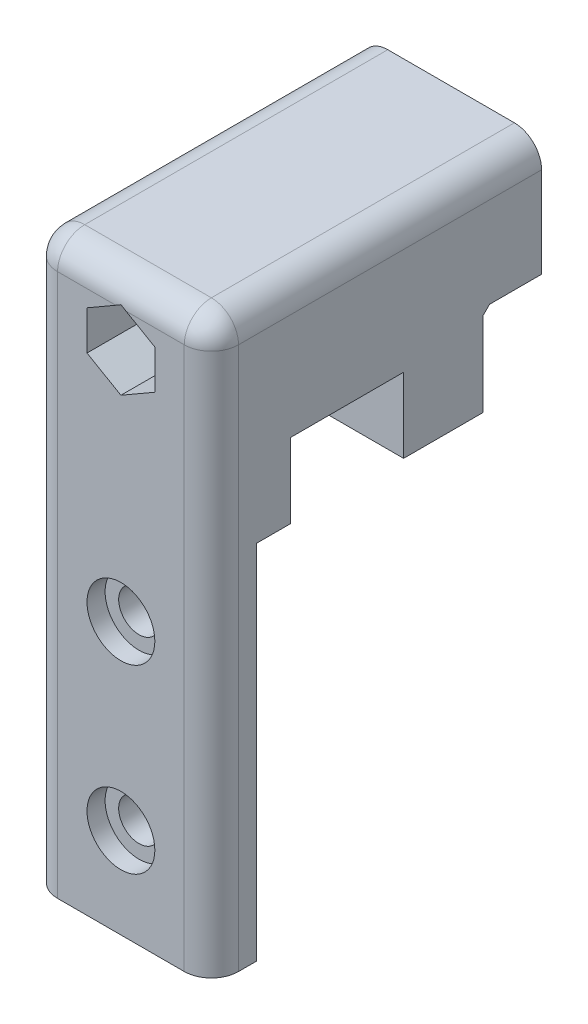
from build123d import *

# Parameters (mm, degrees)
BOSS_EXTRUDE1_DEPTH = 20
CUT_EXTRUDE1_REACH  = 58.482
SKETCH2_R           = 2.25
SKETCH3_W           = 20
SKETCH3_H           = 63
SKETCH3_R           = 3.75
BOSS_EXTRUDE2_DEPTH = 2
FILLET1_R           = 3
CUT_EXTRUDE2_DEPTH  = 10


with BuildPart() as part:
    # Sketch1 → Boss-Extrude1 (new body)
    with BuildSketch(Plane(origin=(0, 0, 0), x_dir=(0, 0, -1), z_dir=(1, 0, 0))):
        Polygon((8.75, 0), (8.75, 9.25), (9.5, 10), (15.25, 10), (15.25, 23), (-19.25, 23), (-19.25, -40), (-16.25, -40), (-16.25, 0), (-12.5, 0), (-12.5, 8.25), (0, 8.25), (0, 0), (3.75, 0), align=None)
    extrude(amount=BOSS_EXTRUDE1_DEPTH)

    # Sketch2 → Cut-Extrude1 (cut, up to next)
    with BuildSketch(Plane.XY.offset(19.25), mode=Mode.PRIVATE) as cut_extrude1_sk1:
        with Locations((10, -30)):
            Circle(SKETCH2_R)
    cut_extrude1_tool1 = extrude(cut_extrude1_sk1.sketch, amount=-CUT_EXTRUDE1_REACH, mode=Mode.PRIVATE) & part.part
    # Sketch2 → Cut-Extrude1 (cut, up to next)
    with BuildSketch(Plane.XY.offset(19.25), mode=Mode.PRIVATE) as cut_extrude1_sk2:
        with Locations((10, -10)):
            Circle(SKETCH2_R)
    cut_extrude1_tool2 = extrude(cut_extrude1_sk2.sketch, amount=-CUT_EXTRUDE1_REACH, mode=Mode.PRIVATE) & part.part
    # Sketch2 → Cut-Extrude1 (cut, up to next)
    with BuildSketch(Plane.XY.offset(19.25), mode=Mode.PRIVATE) as cut_extrude1_sk3:
        with Locations((10, 16)):
            Circle(SKETCH2_R)
    cut_extrude1_tool3 = extrude(cut_extrude1_sk3.sketch, amount=-CUT_EXTRUDE1_REACH, mode=Mode.PRIVATE) & part.part
    add(cut_extrude1_tool1.solids().sort_by_distance((10, -30, 19.25))[0], mode=Mode.SUBTRACT)
    add(cut_extrude1_tool2.solids().sort_by_distance((10, -10, 19.25))[0], mode=Mode.SUBTRACT)
    add(cut_extrude1_tool3.solids().sort_by_distance((10, 16, 19.25))[0], mode=Mode.SUBTRACT)

    # Sketch3 → Boss-Extrude2 (add)
    with BuildSketch(Plane.XY.offset(19.25)):
        with Locations((10, -8.5)):
            Rectangle(SKETCH3_W, SKETCH3_H)
        with Locations((10, -30)):
            Circle(SKETCH3_R, mode=Mode.SUBTRACT)
        with Locations((10, -10)):
            Circle(SKETCH3_R, mode=Mode.SUBTRACT)
        Polygon((13.75, 18.165063509), (10, 20.330127019), (6.25, 18.165063509), (6.25, 13.834936491), (10, 11.669872981), (13.75, 13.834936491), align=None, mode=Mode.SUBTRACT)
    extrude(amount=BOSS_EXTRUDE2_DEPTH)

    # Fillet1
    # the kernel refuses this fillet: 3 mm, written as the material it takes off along each edge
    with BuildSketch(Plane(origin=(3, 20, 18.25), x_dir=(0, 0, 1), z_dir=(-1, 0, 0))) as fillet1_piece_1_section:
        Polygon((0, 0), (FILLET1_R, 0), (FILLET1_R, FILLET1_R), (0, FILLET1_R), align=None)
    fillet1_piece_1 = extrude(amount=FILLET1_R, mode=Mode.PRIVATE)
    fillet1_piece_1 = fillet1_piece_1 - Plane(origin=(3, 20, 18.25), x_dir=(0, -0.7071067811865485, -0.7071067811865465), z_dir=(-1, 0, 0)) * Sphere(FILLET1_R, mode=Mode.PRIVATE)
    add(fillet1_piece_1, mode=Mode.SUBTRACT)
    with BuildSketch(Plane(origin=(17, 20, 18.25), x_dir=(0, 0, 1), z_dir=(1, 0, 0))) as fillet1_piece_2_section:
        Polygon((0, 0), (FILLET1_R, 0), (FILLET1_R, -FILLET1_R), (0, -FILLET1_R), align=None)
    fillet1_piece_2 = extrude(amount=FILLET1_R, mode=Mode.PRIVATE)
    fillet1_piece_2 = fillet1_piece_2 - Plane(origin=(17, 20, 18.25), x_dir=(0, -0.7071067811865485, -0.7071067811865465), z_dir=(1, 0, 0)) * Sphere(FILLET1_R, mode=Mode.PRIVATE)
    add(fillet1_piece_2, mode=Mode.SUBTRACT)
    with BuildSketch(Plane(origin=(0, 23, 18.25), x_dir=(1, 0, 0), z_dir=(0, 0, -1))) as fillet1_piece_3:
        with BuildLine():
            CenterArc((FILLET1_R, FILLET1_R), FILLET1_R, 180, 90)
            Line((0, FILLET1_R), (0, 0))
            Line((0, 0), (FILLET1_R, 0))
        make_face()
    extrude(amount=41, mode=Mode.SUBTRACT)
    with BuildSketch(Plane(origin=(20, 23, -22.75), x_dir=(0, -1, 0), z_dir=(0, 0, 1))) as fillet1_piece_4:
        with BuildLine():
            CenterArc((FILLET1_R, -FILLET1_R), FILLET1_R, 90, 90)
            Line((0, -FILLET1_R), (0, 0))
            Line((0, 0), (FILLET1_R, 0))
        make_face()
    extrude(amount=41, mode=Mode.SUBTRACT)
    with BuildSketch(Plane(origin=(17, 23, 21.25), x_dir=(0, -1, 0), z_dir=(-1, 0, 0))) as fillet1_piece_5:
        with BuildLine():
            CenterArc((FILLET1_R, -FILLET1_R), FILLET1_R, 90, 90)
            Line((0, -FILLET1_R), (0, 0))
            Line((0, 0), (FILLET1_R, 0))
        make_face()
    extrude(amount=14, mode=Mode.SUBTRACT)
    with BuildSketch(Plane(origin=(0, 20, 21.25), x_dir=(1, 0, 0), z_dir=(0, -1, 0))) as fillet1_piece_6:
        with BuildLine():
            CenterArc((FILLET1_R, -FILLET1_R), FILLET1_R, 90, 90)
            Line((0, -FILLET1_R), (0, 0))
            Line((0, 0), (FILLET1_R, 0))
        make_face()
    extrude(amount=67.5, mode=Mode.SUBTRACT)
    with BuildSketch(Plane(origin=(20, -47.5, 21.25), x_dir=(0, 0, -1), z_dir=(0, 1, 0))) as fillet1_piece_7:
        with BuildLine():
            CenterArc((FILLET1_R, FILLET1_R), FILLET1_R, 180, 90)
            Line((0, FILLET1_R), (0, 0))
            Line((0, 0), (FILLET1_R, 0))
        make_face()
    extrude(amount=67.5, mode=Mode.SUBTRACT)

    # Sketch4 → Cut-Extrude2 (cut)
    with BuildSketch(Plane.XY.offset(19.25)):
        Polygon((10, 11.669872981), (13.75, 13.834936491), (13.75, 18.165063509), (10, 20.330127019), (6.25, 18.165063509), (6.25, 13.834936491), align=None)
    extrude(amount=-CUT_EXTRUDE2_DEPTH, mode=Mode.SUBTRACT)


solid = part.part
